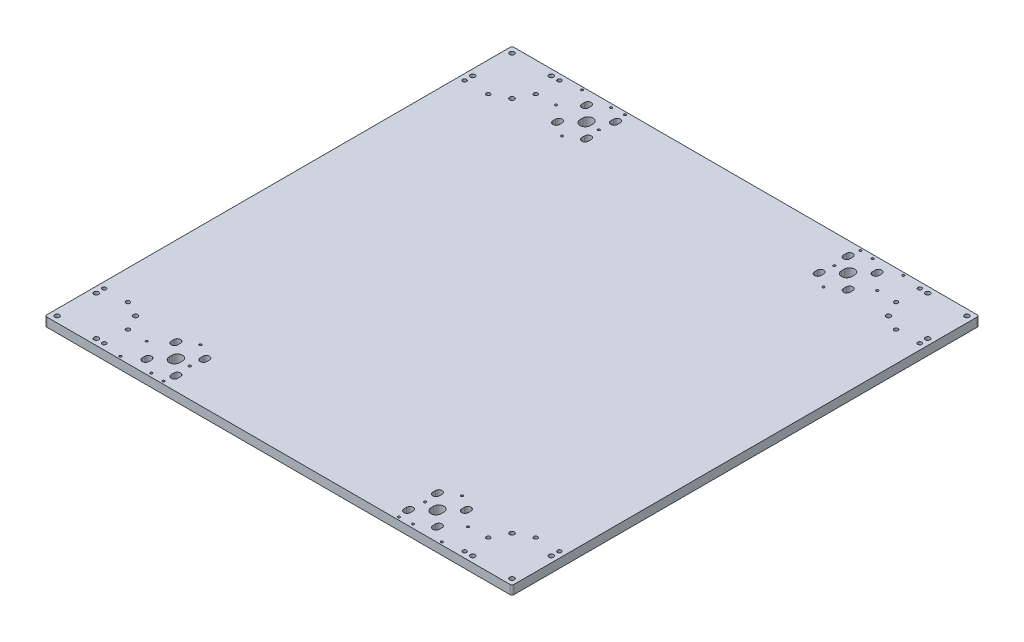
from build123d import *

# Parameters (mm, degrees)
SKETCH1_W                       = 500
SKETCH1_H                       = 500
BOSS_EXTRUDE1_DEPTH             = 9.525
TAP_DRILL_FOR_M3X0_5_TAP1_D     = 2.5
TAP_DRILL_FOR_M6X1_0_TAP1_D     = 5
TAP_DRILL_FOR_M5X0_8_TAP1_D     = 4.2
CIRPATTERN1_COUNT               = 4
F_11_0_11_DIAMETER_SLOT1_DEPTH  = 9.525
F_7_0_7_DIAMETER_SLOT1_DEPTH    = 9.525
TAP_DRILL_FOR_M3X0_5_TAP3_D     = 2.5
TAP_DRILL_FOR_M3X0_5_TAP3_DEPTH = 9.525
MIRROR2_COPY_1_DEPTH            = 9.525
MIRROR2_COPY_2_DEPTH            = 9.525
MIRROR2_COPY_3_D                = 2.5
MIRROR2_COPY_3_DEPTH            = 9.525
FILLET1_R                       = 2


# Read off the part's stored shape, not the designer's step: Ø11.0 (11) Diameter Slot1, Ø7.0 (7) Diameter Slot1
with BuildPart() as part:
    # Sketch1 → Boss-Extrude1 (new body)
    with BuildSketch(Plane(origin=(0, 0, 0), x_dir=(1, 0, 0), z_dir=(0, 1, 0))):
        Rectangle(SKETCH1_W, SKETCH1_H)
    extrude(amount=BOSS_EXTRUDE1_DEPTH)

    # Tap Drill for M3x0.5 Tap1 (through all)
    with Locations(Plane(origin=(0, 9.525, 0), x_dir=(1, 0, 0), z_dir=(0, 1, 0))):
        with Locations((172, -219), (126, -219), (126, -247), (172, -247), (-126, -219), (-172, -219), (-172, -247), (-126, -247), (-126, 247), (-172, 247), (-172, 219), (-126, 219), (126, 247), (172, 247), (172, 219), (126, 219)):
            Hole(TAP_DRILL_FOR_M3X0_5_TAP1_D / 2)

    # Tap Drill for M6x1.0 Tap1 (through all)
    with Locations(Plane(origin=(0, 9.525, 0), x_dir=(1, 0, 0), z_dir=(0, 1, 0))):
        with Locations((243.5, -243.5), (201.5, -201.5), (243.5, -201.5), (201.5, -243.5)):
            tap_drill_for_m6x1_0_tap1 = Hole(TAP_DRILL_FOR_M6X1_0_TAP1_D / 2)

    # Tap Drill for M5x0.8 Tap1 (through all)
    with Locations(Plane(origin=(0, 9.525, 0), x_dir=(1, 0, 0), z_dir=(0, 1, 0))):
        with Locations((192.85, -243.65), (192.85, -218.25), (218.25, -192.85), (243.65, -192.85)):
            tap_drill_for_m5x0_8_tap1 = Hole(TAP_DRILL_FOR_M5X0_8_TAP1_D / 2)

    # CirPattern1: Tap Drill for M6x1.0 Tap1, Tap Drill for M5x0.8 Tap1 ×4 about axis
    cirpattern1_axis = Axis((0, 0, 0), (0, 1, 0))
    add([tap_drill_for_m6x1_0_tap1.rotate(cirpattern1_axis, i * 360 / CIRPATTERN1_COUNT) for i in range(1, CIRPATTERN1_COUNT)], mode=Mode.SUBTRACT)
    add([tap_drill_for_m5x0_8_tap1.rotate(cirpattern1_axis, i * 360 / CIRPATTERN1_COUNT) for i in range(1, CIRPATTERN1_COUNT)], mode=Mode.SUBTRACT)

    # Ø11.0 (11) Diameter Slot1 outline → Ø11.0 (11) Diameter Slot1 (cut)
    with BuildSketch(Plane(origin=(0, 0, 0), x_dir=(1, 0, 0), z_dir=(0, 1, 0))):
        with BuildLine():
            Line((-134.5, -221.3), (-134.5, -218.3))
            ThreePointArc((-134.5, -218.3), (-140, -212.8), (-145.5, -218.3))
            Line((-145.5, -218.3), (-145.5, -221.3))
            ThreePointArc((-145.5, -221.3), (-140, -226.8), (-134.5, -221.3))
        make_face()
    f_11_0_11_diameter_slot1 = extrude(amount=F_11_0_11_DIAMETER_SLOT1_DEPTH, mode=Mode.SUBTRACT)

    # Ø7.0 (7) Diameter Slot1 outline → Ø7.0 (7) Diameter Slot1 (cut)
    with BuildSketch(Plane(origin=(0, 0, 0), x_dir=(1, 0, 0), z_dir=(0, 1, 0))):
        with BuildLine():
            Line((-152, -236.8), (-152, -233.8))
            ThreePointArc((-152, -233.8), (-155.5, -230.3), (-159, -233.8))
            Line((-159, -233.8), (-159, -236.8))
            ThreePointArc((-159, -236.8), (-155.5, -240.3), (-152, -236.8))
        make_face()
        with BuildLine():
            ThreePointArc((-152, -202.8), (-155.5, -199.3), (-159, -202.8))
            Line((-159, -202.8), (-159, -205.8))
            ThreePointArc((-159, -205.8), (-155.5, -209.3), (-152, -205.8))
            Line((-152, -205.8), (-152, -202.8))
        make_face()
        with BuildLine():
            Line((-121, -205.8), (-121, -202.8))
            ThreePointArc((-121, -202.8), (-124.5, -199.3), (-128, -202.8))
            Line((-128, -202.8), (-128, -205.8))
            ThreePointArc((-128, -205.8), (-124.5, -209.3), (-121, -205.8))
        make_face()
        with BuildLine():
            ThreePointArc((-121, -233.8), (-124.5, -230.3), (-128, -233.8))
            Line((-128, -233.8), (-128, -236.8))
            ThreePointArc((-128, -236.8), (-124.5, -240.3), (-121, -236.8))
            Line((-121, -236.8), (-121, -233.8))
        make_face()
    f_7_0_7_diameter_slot1 = extrude(amount=F_7_0_7_DIAMETER_SLOT1_DEPTH, mode=Mode.SUBTRACT)

    # Tap Drill for M3x0.5 Tap3
    with Locations(Plane(origin=(0, 0, 0), x_dir=(-1, 0, 0), z_dir=(0, -1, 0))):
        with Locations((140, -193.55), (140, -246.05), (140, -219.8)):
            tap_drill_for_m3x0_5_tap3 = Hole(TAP_DRILL_FOR_M3X0_5_TAP3_D / 2, depth=TAP_DRILL_FOR_M3X0_5_TAP3_DEPTH)

    # Mirror1: Ø11.0 (11) Diameter Slot1, Ø7.0 (7) Diameter Slot1, Tap Drill for M3x0.5 Tap3 across plane
    add(f_11_0_11_diameter_slot1.mirror(Plane(origin=(0, 0, 0), x_dir=(0, 0, 1), z_dir=(1, 0, 0))), mode=Mode.SUBTRACT)
    add(f_7_0_7_diameter_slot1.mirror(Plane(origin=(0, 0, 0), x_dir=(0, 0, 1), z_dir=(1, 0, 0))), mode=Mode.SUBTRACT)
    add(tap_drill_for_m3x0_5_tap3.mirror(Plane(origin=(0, 0, 0), x_dir=(0, 0, 1), z_dir=(1, 0, 0))), mode=Mode.SUBTRACT)

    # Mirror2: Ø11.0 (11) Diameter Slot1, Ø7.0 (7) Diameter Slot1, Tap Drill for M3x0.5 Tap3 across plane
    add(f_11_0_11_diameter_slot1.mirror(Plane.XY), mode=Mode.SUBTRACT)
    add(f_7_0_7_diameter_slot1.mirror(Plane.XY), mode=Mode.SUBTRACT)
    add(tap_drill_for_m3x0_5_tap3.mirror(Plane.XY), mode=Mode.SUBTRACT)

    # Mirror2 copy 1 sketch → Mirror2 copy 1 (cut)
    with BuildSketch(Plane(origin=(0, 0, 0), x_dir=(-1, 0, 0), z_dir=(0, 1, 0))):
        with BuildLine():
            Line((-134.5, -221.3), (-134.5, -218.3))
            ThreePointArc((-134.5, -218.3), (-140, -212.8), (-145.5, -218.3))
            Line((-145.5, -218.3), (-145.5, -221.3))
            ThreePointArc((-145.5, -221.3), (-140, -226.8), (-134.5, -221.3))
        make_face()
    extrude(amount=MIRROR2_COPY_1_DEPTH, mode=Mode.SUBTRACT)

    # Mirror2 copy 2 sketch → Mirror2 copy 2 (cut)
    with BuildSketch(Plane(origin=(0, 0, 0), x_dir=(-1, 0, 0), z_dir=(0, 1, 0))):
        with BuildLine():
            Line((-152, -236.8), (-152, -233.8))
            ThreePointArc((-152, -233.8), (-155.5, -230.3), (-159, -233.8))
            Line((-159, -233.8), (-159, -236.8))
            ThreePointArc((-159, -236.8), (-155.5, -240.3), (-152, -236.8))
        make_face()
        with BuildLine():
            ThreePointArc((-152, -202.8), (-155.5, -199.3), (-159, -202.8))
            Line((-159, -202.8), (-159, -205.8))
            ThreePointArc((-159, -205.8), (-155.5, -209.3), (-152, -205.8))
            Line((-152, -205.8), (-152, -202.8))
        make_face()
        with BuildLine():
            Line((-121, -205.8), (-121, -202.8))
            ThreePointArc((-121, -202.8), (-124.5, -199.3), (-128, -202.8))
            Line((-128, -202.8), (-128, -205.8))
            ThreePointArc((-128, -205.8), (-124.5, -209.3), (-121, -205.8))
        make_face()
        with BuildLine():
            ThreePointArc((-121, -233.8), (-124.5, -230.3), (-128, -233.8))
            Line((-128, -233.8), (-128, -236.8))
            ThreePointArc((-128, -236.8), (-124.5, -240.3), (-121, -236.8))
            Line((-121, -236.8), (-121, -233.8))
        make_face()
    extrude(amount=MIRROR2_COPY_2_DEPTH, mode=Mode.SUBTRACT)

    # Mirror2 copy 3
    with Locations(Plane.XZ):
        with Locations((140, -193.55), (140, -246.05), (140, -219.8)):
            Hole(MIRROR2_COPY_3_D / 2, depth=MIRROR2_COPY_3_DEPTH)

    # Fillet1
    fillet1_edges = [part.edges().sort_by_distance(p)[0] for p in [
        (-250, 4.7625, -250),
        (250, 4.7625, -250),
        (250, 4.7625, 250),
        (-250, 4.7625, 250),
    ]]
    fillet(fillet1_edges, radius=FILLET1_R)


solid = part.part
